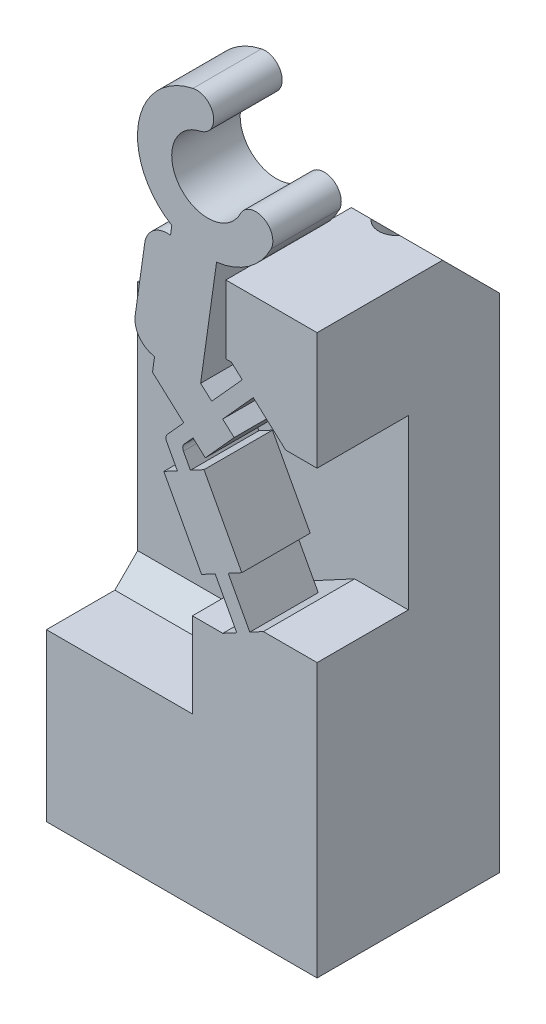
from build123d import *
from build123d.topology import SkipClean

# Parameters (mm, degrees)
BOSS_SWITCH_BODY_DEPTH        = 3
SKETCH1_W                     = 4
SKETCH1_H                     = 5.146726578
BOSS_FLANGE_WIDTH_DEPTH       = 5
BOSS_FLANGE_HEIGHT_REACH      = 32.536
SKETCH2_W                     = 4
SKETCH2_H                     = 5.146726578
SKETCH2_W_2                   = 8
SKETCH2_H_2                   = 0.29195361
SKETCH17_W                    = 11.865577264
SKETCH17_H                    = 4
BOSS_FLANGE_SUPPORT_DEPTH     = 12.061319812
CUT_WALL_GAP_DEPTH            = 1
SKETCH26_W                    = 7.865577264
SKETCH26_H                    = 6
CUT_CAM_SLOPE_CLEARANCE_DEPTH = 29.549094119
TAP_DRILL_FOR_M2X0_4_TAP1_D   = 1.6
M2_CLEARANCE_HOLE2_D          = 2.4
M2_CLEARANCE_HOLE2_DEPTH      = 6.5
CHAMFER_FLANGE_SUPPORT_3_SIZE = 1
SKETCH25_W                    = 5.078666947
SKETCH25_H                    = 17.5
CUT_BASE_REMOVAL_DEPTH        = 3
CHAMFER8_SIZE                 = 2.5
SKETCH28_R                    = 1.2
BOSS_REAR_FILL_DEPTH          = 7


with BuildPart() as part:
    # Sketch-SwitchBossUp → Boss-Switch Body (new body)
    with BuildSketch(Plane.XY):
        with BuildLine():
            Line((1.921762003, 19.221250523), (1.86470337, 18.817184497))
            ThreePointArc((1.86470337, 18.817184497), (1.123589449, 18.626039018), (0.734703034, 17.966832076))
            Line((0.734703034, 17.966832076), (0.315231161, 14.996302939))
            ThreePointArc((0.315231161, 14.996302939), (0.506376639, 14.255189019), (1.165583582, 13.866302603))
            Line((1.165583582, 13.866302603), (1.074853013, 13.223785628))
            Line((1.074853013, 13.223785628), (1.905726754, 12.473719244))
            Line((1.905726754, 12.473719244), (2.444726799, 11.987140122))
            Line((2.444726799, 11.987140122), (1.726981331, 11.192069347))
            ThreePointArc((1.726981331, 11.192069347), (1.664368515, 11.054634089), (1.692327837, 10.906218823))
            Line((1.692327837, 10.906218823), (2.164939967, 10.026628353))
            Line((2.164939967, 10.026628353), (1.570336216, 9.707142235))
            Line((1.570336216, 9.707142235), (3.226930905, 6.624011677))
            Line((3.226930905, 6.624011677), (3.821534656, 6.943497796))
            Line((3.821534656, 6.943497796), (4.768160192, 5.181708905))
            Line((4.768160192, 5.181708905), (4.157214411, 4.853442062))
            Line((4.157214411, 4.853442062), (2.82580452, 4.853442062))
            Line((2.82580452, 4.853442062), (2.82580452, 4.353442062))
            Line((2.82580452, 4.353442062), (2.82580452, 1.126380759))
            Line((2.82580452, 1.126380759), (3.260297574, 1.126380759))
            Line((3.260297574, 1.126380759), (3.260297574, 0.834427149))
            Line((3.260297574, 0.834427149), (5.219466869, 0.834427149))
            Line((5.219466869, 0.834427149), (13.368774055, 0.834427149))
            Line((13.368774055, 0.834427149), (13.368774055, 18.334427149))
            Line((13.368774055, 18.334427149), (7.056733116, 18.334427149))
            Line((7.056733116, 18.334427149), (4.290107108, 18.334427149))
            Line((4.290107108, 18.334427149), (4.290107108, 15.334427149))
            Line((4.290107108, 15.334427149), (4.534260481, 15.334427149))
            Line((4.534260481, 15.334427149), (5.009929091, 14.905020107))
            Line((5.009929091, 14.905020107), (3.669750435, 13.420459172))
            Line((3.669750435, 13.420459172), (3.184345862, 13.858655297))
            Line((3.184345862, 13.858655297), (3.88324993, 18.808009555))
            ThreePointArc((3.88324993, 18.808009555), (5.291733051, 19.354544283), (6.272283418, 20.503911887))
            ThreePointArc((6.272283418, 20.503911887), (5.932330877, 21.508616953), (4.927625811, 21.168664412))
            ThreePointArc((4.927625811, 21.168664412), (2.253195858, 20.895301387), (3.167340926, 23.423471024))
            ThreePointArc((3.167340926, 23.423471024), (3.740925778, 24.315659579), (2.848737223, 24.889244431))
            ThreePointArc((2.848737223, 24.889244431), (0.457510485, 22.370520646), (1.921762003, 19.221250523))
        make_face()
        with BuildLine():
            Line((6.935345332, 5.808848323), (10.437466736, 5.808848323))
            Line((10.437466736, 5.808848323), (10.437466736, 13.187700571))
            Line((10.437466736, 13.187700571), (6.912261653, 13.187700571))
            Line((6.912261653, 13.187700571), (5.492411395, 14.469462044))
            Line((5.492411395, 14.469462044), (4.152232739, 12.984901109))
            Line((4.152232739, 12.984901109), (4.653272054, 12.532590813))
            Line((4.653272054, 12.532590813), (3.390287689, 11.133540588))
            Line((3.390287689, 11.133540588), (2.851287644, 11.620119709))
            Line((2.851287644, 11.620119709), (2.464867696, 11.192069347))
            ThreePointArc((2.464867696, 11.192069347), (2.40225488, 11.054634089), (2.430214202, 10.906218823))
            Line((2.430214202, 10.906218823), (2.737521356, 10.334281653))
            Line((2.737521356, 10.334281653), (3.332125106, 10.653767771))
            Line((3.332125106, 10.653767771), (4.988719795, 7.570637214))
            Line((4.988719795, 7.570637214), (4.394116045, 7.251151095))
            Line((4.394116045, 7.251151095), (5.340741582, 5.489362205))
            Line((5.340741582, 5.489362205), (5.935345332, 5.808848323))
            Line((5.935345332, 5.808848323), (6.935345332, 5.808848323))
        make_face(mode=Mode.SUBTRACT)
    extrude(amount=BOSS_SWITCH_BODY_DEPTH)

    # Sketch1 → Boss-Flange Width (add)
    with BuildSketch(Plane(origin=(0, 0, 0), x_dir=(-1, 0, 0), z_dir=(0, 0, -1))):
        Polygon((-8.290107108, 5.808848323), (-5.935345332, 5.808848323), (-4.157214411, 4.853442062), (-2.82580452, 4.853442062), (-2.82580452, 1.126380759), (0.412170615, 1.126380759), (0.412170615, 0.834427149), (-8.290107108, 0.834427149), (-8.290107108, 1.426550232), align=None)
        with Locations((-6.290107108, 15.76106386)):
            Rectangle(SKETCH1_W, SKETCH1_H)
    extrude(amount=BOSS_FLANGE_WIDTH_DEPTH)

    # Sketch2 → Boss-Flange Height (add, up to next)
    with BuildSketch(Plane(origin=(-3.575470156, 0, 0), x_dir=(0, 0, -1), z_dir=(1, 0, 0)), mode=Mode.PRIVATE) as boss_flange_height_sk1:
        with Locations((3, 15.76106386)):
            Rectangle(SKETCH2_W, SKETCH2_H)
    boss_flange_height_tool1 = extrude(boss_flange_height_sk1.sketch, amount=BOSS_FLANGE_HEIGHT_REACH, mode=Mode.PRIVATE) - part.part
    # Sketch2 → Boss-Flange Height (add, up to next)
    with BuildSketch(Plane(origin=(-3.575470156, 0, 0), x_dir=(0, 0, -1), z_dir=(1, 0, 0)), mode=Mode.PRIVATE) as boss_flange_height_sk2:
        with Locations((1, 0.980403954)):
            Rectangle(SKETCH2_W_2, SKETCH2_H_2)
    boss_flange_height_tool2 = extrude(boss_flange_height_sk2.sketch, amount=BOSS_FLANGE_HEIGHT_REACH, mode=Mode.PRIVATE) - part.part
    add(boss_flange_height_tool1.solids().sort_by_distance((-3.57547, 15.761064, -3))[0])
    add(boss_flange_height_tool2.solids().sort_by_distance((-3.57547, 0.980404, -1))[0])

    # Sketch17 → Boss-Flange Support (add)
    with BuildSketch(Plane.XZ.offset(-1.126380759)):
        with Locations((2.357318476, -3)):
            Rectangle(SKETCH17_W, SKETCH17_H)
    extrude(amount=-BOSS_FLANGE_SUPPORT_DEPTH)

    # Sketch27 → Cut-Wall Gap (cut)
    with BuildSketch(Plane.XY):
        Polygon((4.290107108, 15.334427149), (4.534260481, 15.334427149), (6.912261653, 13.187700571), (4.290107108, 13.187700571), align=None)
    extrude(amount=-CUT_WALL_GAP_DEPTH, mode=Mode.SUBTRACT)

    # Sketch26 → Cut-Cam Slope Clearance (cut, through all)
    with BuildSketch(Plane.XY.offset(-1)):
        with Locations((0.357318476, 15.334427149)):
            Rectangle(SKETCH26_W, SKETCH26_H)
    extrude(amount=-CUT_CAM_SLOPE_CLEARANCE_DEPTH, mode=Mode.SUBTRACT)

    # Tap Drill for M2x0.4 Tap1 (through all)
    with Locations(Plane(origin=(0, 0.834427149, 0), x_dir=(-1, 0, 0), z_dir=(0, -1, 0))):
        with Locations((0.575470156, 3), (-5.790107108, 3)):
            Hole(TAP_DRILL_FOR_M2X0_4_TAP1_D / 2)

    # M2 Clearance Hole2
    with Locations(Plane.XZ.offset(-0.834427149)):
        with Locations((-0.575470156, -3), (5.790107108, -3)):
            Hole(M2_CLEARANCE_HOLE2_D / 2, depth=M2_CLEARANCE_HOLE2_DEPTH)

    # Chamfer-Flange Support 3
    chamfer_flange_support_3_edges = [part.edges().sort_by_distance(p)[0] for p in [
        (-0.374832818, 1.126380759, -1),
    ]]
    chamfer(chamfer_flange_support_3_edges, length=CHAMFER_FLANGE_SUPPORT_3_SIZE)

    # Sketch25 → Cut-Base Removal (cut)
    with BuildSketch(Plane.XY.offset(3)):
        with Locations((10.829440582, 9.584427149)):
            Rectangle(SKETCH25_W, SKETCH25_H)
    extrude(amount=-CUT_BASE_REMOVAL_DEPTH, mode=Mode.SUBTRACT)

    # Chamfer8
    # the kernel refuses this chamfer: 2.5 mm, written as the material it takes off along each edge
    with BuildSketch(Plane(origin=(14.719314578, 18.334427149, -5), x_dir=(0, -0.9996219169112968, -0.027495876610586317), z_dir=(-1, 0, 0))) as chamfer8_piece_1:
        Polygon((CHAMFER8_SIZE * 0.999621916911, CHAMFER8_SIZE * 0.0274958766106), (-CHAMFER8_SIZE * 0.0274958766106, CHAMFER8_SIZE * 0.999621916911), (0, 0), align=None)
    extrude(amount=16.85841494, mode=Mode.SUBTRACT)

    # Sketch28 → Boss-Rear Fill (add)
    with SkipClean():  # the faces are left unmerged after this step: merging them gives an invalid solid
        with BuildSketch(Plane.XZ.offset(-0.834427149)):
            Polygon((-3.575470156, 3), (8.290107108, 3), (8.290107108, 0), (8.290107108, -5), (-3.575470156, -5), align=None)
            with Locations((5.790107108, -3)):
                Circle(SKETCH28_R, mode=Mode.SUBTRACT)
            with Locations((-0.575470156, -3)):
                Circle(SKETCH28_R, mode=Mode.SUBTRACT)
        extrude(amount=BOSS_REAR_FILL_DEPTH)


solid = part.part
